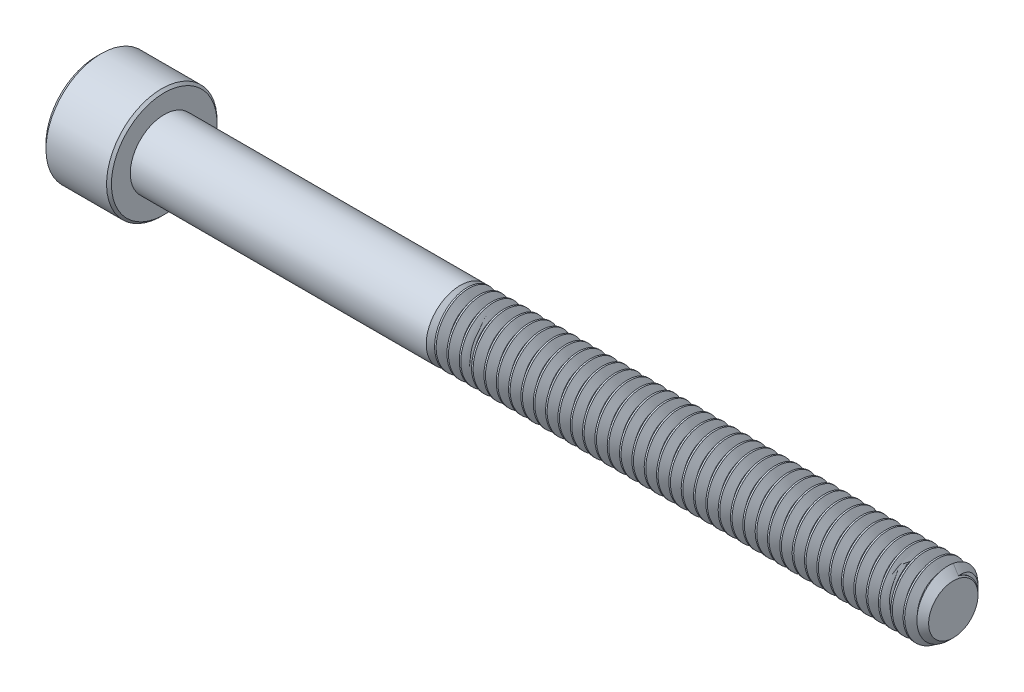
from build123d import *

# Parameters (mm, degrees)
SKETCH2_R           = 1.0922
BOSS_EXTRUDE1_DEPTH = 15.875
CHAMFER1_SIZE       = 0.29765625
CUT_SWEEP1_PITCH    = 0.396875
CUT_EXTRUDE1_DEPTH  = 0.9652
SKETCH8_R           = 1.14567944
CUT_EXTRUDE2_DEPTH  = 0.312057143
CUT_EXTRUDE2_DRAFT  = -45


with BuildPart() as part:
    # Sketch2 → Boss-Extrude1 (new body)
    with BuildSketch(Plane(origin=(12.7, 0, 0), x_dir=(0, 0, -1), z_dir=(1, 0, 0))):
        Circle(SKETCH2_R)
    extrude(amount=-BOSS_EXTRUDE1_DEPTH)

    # Chamfer1
    chamfer1_edges = [part.edges().sort_by_distance(p)[0] for p in [
        (12.7, 0, 1.0922),
    ]]
    chamfer(chamfer1_edges, length=CHAMFER1_SIZE)

    # Cut-Sweep1: the profile of Sketch5 profile screwed along a right-hand helix of 41 turns, 6 arcs to a turn; built about Z, then put on its axis
    cut_sweep1_z = Axis((0, 0, 0), (0, 0, 1))
    cut_sweep1_corners = [(1.0925, 0, 0.173806018), (1.0925, 0, -0.173806018), (0.834422126, 0, -0.024804687), (0.834422126, 0, 0.024804688)]
    with BuildLine(mode=Mode.PRIVATE) as cut_sweep1_profile:
        Line(cut_sweep1_corners[0], cut_sweep1_corners[1])
        Line(cut_sweep1_corners[1], cut_sweep1_corners[2])
        Line(cut_sweep1_corners[2], cut_sweep1_corners[3])
        Line(cut_sweep1_corners[3], cut_sweep1_corners[0])
    cut_sweep1_cap = Face(cut_sweep1_profile.wire())
    cut_sweep1_turn_angles = [0, 30, 60, 90, 120, 150, 180, 210, 240, 270, 300, 330, 360, 390, 420, 450, 480, 510, 540, 570, 600, 630, 660, 690, 720]
    cut_sweep1_turn_weights = [1, 0.8660254037844387, 1, 0.8660254037844387, 1, 0.8660254037844387, 1, 0.8660254037844387, 1, 0.8660254037844387, 1, 0.8660254037844387, 1, 0.8660254037844387, 1, 0.8660254037844387, 1, 0.8660254037844387, 1, 0.8660254037844387, 1, 0.8660254037844387, 1, 0.8660254037844387, 1]
    cut_sweep1_turn_rails = [Edge.make_bspline([Vector(p[0], p[1], 0).rotate(cut_sweep1_z, cut_sweep1_turn_angles[k]) / cut_sweep1_turn_weights[k] + Vector(0, 0, p[2] + CUT_SWEEP1_PITCH * cut_sweep1_turn_angles[k] / 360) for k in range(25)], [0, 0, 0, 1, 1, 2, 2, 3, 3, 4, 4, 5, 5, 6, 6, 7, 7, 8, 8, 9, 9, 10, 10, 11, 11, 12, 12, 12], 2, cut_sweep1_turn_weights) for p in cut_sweep1_corners]
    cut_sweep1_turn_sides = [Face.make_surface_from_curves(cut_sweep1_turn_rails[p[0]], cut_sweep1_turn_rails[p[1]]) for p in [(0, 1), (1, 2), (2, 3), (3, 0)]]
    cut_sweep1_last_angles = [14400, 14430, 14460, 14490, 14520, 14550, 14580, 14610, 14640, 14670, 14700, 14730, 14760]
    cut_sweep1_last_weights = [1, 0.8660254037844387, 1, 0.8660254037844387, 1, 0.8660254037844387, 1, 0.8660254037844387, 1, 0.8660254037844387, 1, 0.8660254037841132, 1]
    cut_sweep1_last_rails = [Edge.make_bspline([Vector(p[0], p[1], 0).rotate(cut_sweep1_z, cut_sweep1_last_angles[k]) / cut_sweep1_last_weights[k] + Vector(0, 0, p[2] + CUT_SWEEP1_PITCH * cut_sweep1_last_angles[k] / 360) for k in range(13)], [0, 0, 0, 1, 1, 2, 2, 3, 3, 4, 4, 5, 5, 6, 6, 6], 2, cut_sweep1_last_weights) for p in cut_sweep1_corners]
    cut_sweep1_last_sides = [Face.make_surface_from_curves(cut_sweep1_last_rails[p[0]], cut_sweep1_last_rails[p[1]]) for p in [(0, 1), (1, 2), (2, 3), (3, 0)]]
    cut_sweep1 = Plane(origin=(12.7, 0, 0), x_dir=(0, 1, 0), z_dir=(-1, 0, 0)) * Solid(Shell([*[p.moved(Location((0, 0, 2 * CUT_SWEEP1_PITCH * i))) for i in range(20) for p in cut_sweep1_turn_sides], *cut_sweep1_last_sides, cut_sweep1_cap, cut_sweep1_cap.rotate(cut_sweep1_z, 14760).moved(Location((0, 0, CUT_SWEEP1_PITCH * 14760 / 360)))]))
    add(cut_sweep1, mode=Mode.SUBTRACT)

    # Sketch10 → Revolve2 (revolve)
    with BuildSketch(Plane.XY, mode=Mode.PRIVATE) as revolve2_sk:
        Polygon((-12.7, 0), (-12.7, 1.0922), (-3.175, 1.0922), (-2.0828, 0), align=None)
    revolve(revolve2_sk.sketch.rotate(Axis((-12.7, 0, 0), (1, 0, 0)), 292.024312837), axis=Axis((-12.7, 0, 0), (1, 0, 0)))

    # Sketch6 → Revolve1 (revolve)
    with BuildSketch(Plane.XY, mode=Mode.PRIVATE) as revolve1_sk:
        Polygon((-14.728371429, 1.778), (-14.8844, 1.621971429), (-14.8844, 0), (-12.7, 0), (-12.7, 1.699985714), (-12.778014286, 1.778), align=None)
    revolve(revolve1_sk.sketch.rotate(Axis((-12.7, 0, 0), (-1, 0, 0)), 67.975687163), axis=Axis((-12.7, 0, 0), (-1, 0, 0)))

    # Sketch4 → Cut-Extrude1 (cut)
    with BuildSketch(Plane(origin=(-14.8844, 0, 0), x_dir=(0, 0, -1), z_dir=(1, 0, 0))):
        Polygon((0, 1.14567944), (-0.9921875, 0.57283972), (-0.9921875, -0.57283972), (0, -1.14567944), (0.9921875, -0.57283972), (0.9921875, 0.57283972), align=None)
    extrude(amount=CUT_EXTRUDE1_DEPTH, mode=Mode.SUBTRACT)


with BuildPart() as cut_extrude2_tool:
    # Sketch8 → Cut-Extrude2 (with draft: the straight prism first)
    with BuildSketch(Plane.ZY.offset(14.8844)):
        Circle(SKETCH8_R)
    extrude(amount=-CUT_EXTRUDE2_DEPTH)
    # Cut-Extrude2: the draft: its side faces are tilted about the plane it starts from
    cut_extrude2_sides = [cut_extrude2_tool.faces().sort_by_distance(p)[0] for p in [
        (-14.728371429, 0, -1.14567944),
    ]]
    draft(cut_extrude2_sides, Plane.ZY.offset(14.8844), CUT_EXTRUDE2_DRAFT)


with BuildPart() as part_1:
    add(part.part)

    # Cut-Extrude2: cut by cut_extrude2_tool
    add(cut_extrude2_tool.part, mode=Mode.SUBTRACT)


solid = part_1.part
